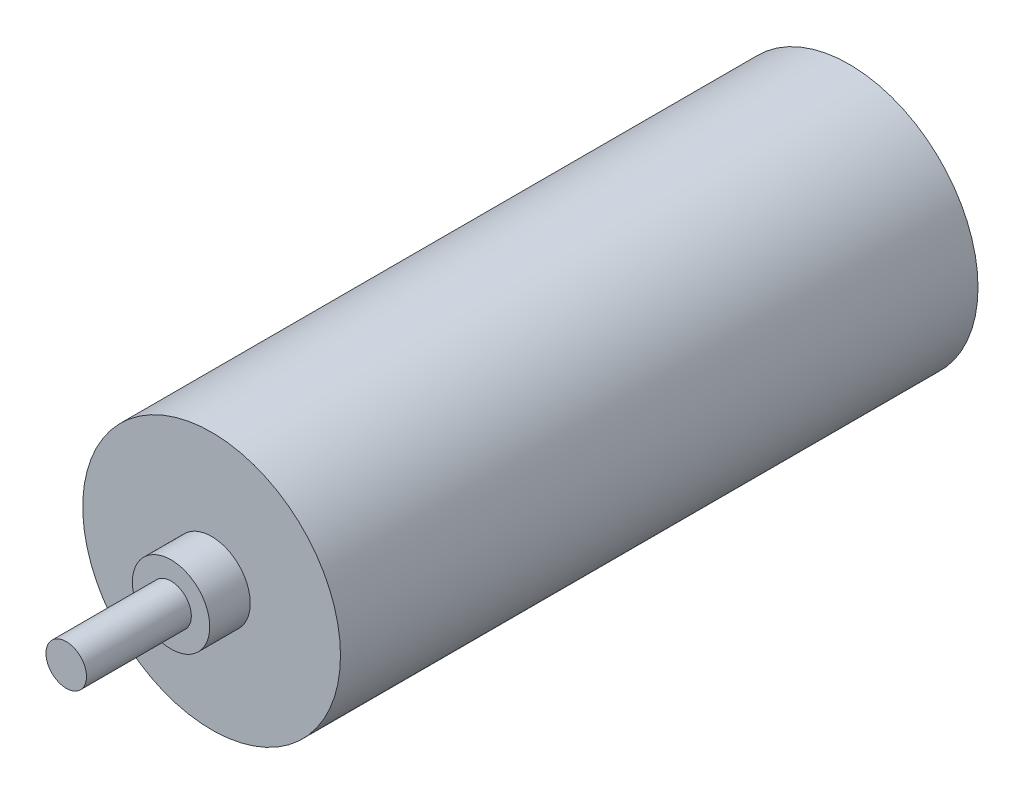
from build123d import *

# Parameters (mm, degrees)
SKETCH1_R           = 19.05
BOSS_EXTRUDE1_DEPTH = 94.234
SKETCH2_R           = 5.715
BOSS_EXTRUDE2_DEPTH = 5.9944
SKETCH3_R           = 2.9972
BOSS_EXTRUDE3_DEPTH = 15.494


with BuildPart() as part:
    # Sketch1 → Boss-Extrude1 (new body)
    with BuildSketch(Plane.XY):
        Circle(SKETCH1_R)
    extrude(amount=BOSS_EXTRUDE1_DEPTH)

    # Sketch2 → Boss-Extrude2 (add)
    with BuildSketch(Plane.XY.offset(94.234)):
        Circle(SKETCH2_R)
    extrude(amount=BOSS_EXTRUDE2_DEPTH)

    # Sketch3 → Boss-Extrude3 (add)
    with BuildSketch(Plane.XY.offset(100.2284)):
        Circle(SKETCH3_R)
    extrude(amount=BOSS_EXTRUDE3_DEPTH)


solid = part.part
